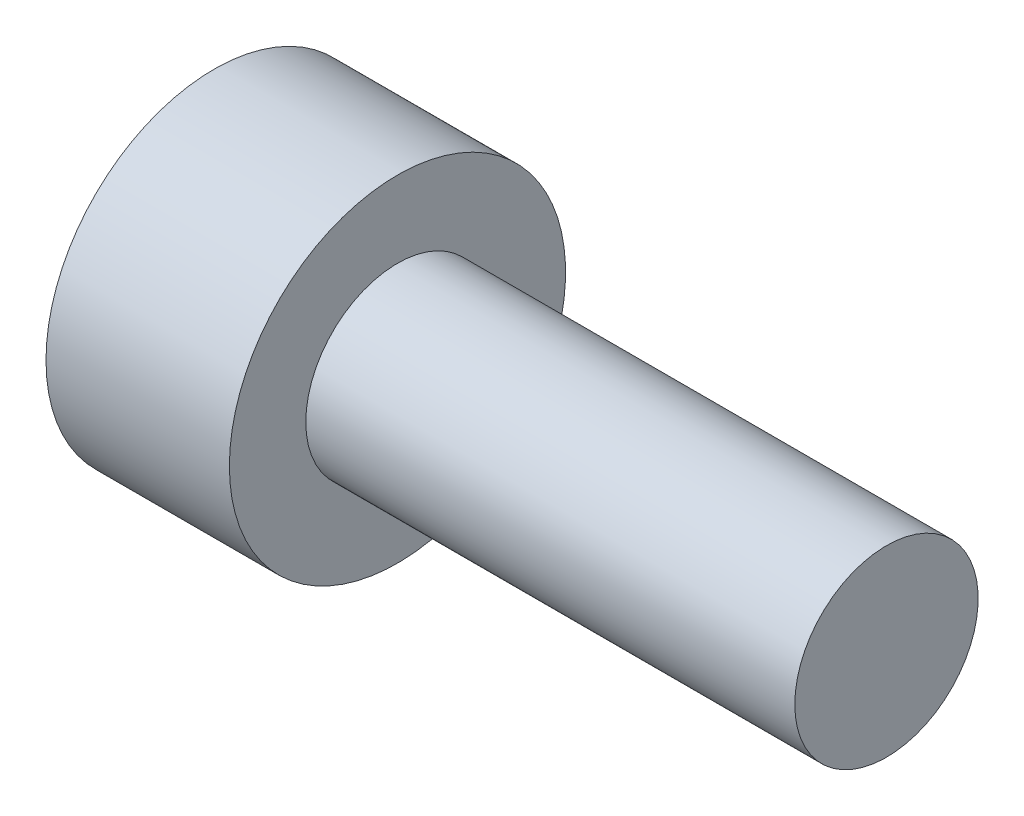
from build123d import *

# Parameters (mm, degrees)
SOCKET_DEPTH = 1.5


with BuildPart() as part:
    # Screw Sketch → Screw (revolve)
    with BuildSketch(Plane.XY):
        Polygon((-3, 0), (-3, 2.75), (0, 2.75), (0, 1.5), (8, 1.5), (8, 0), align=None)
    revolve(axis=Axis((-1000, 0, 0), (1, 0, 0)))

    # Socket Sketch → Socket (cut)
    with BuildSketch(Plane(origin=(-3, 0, 0), x_dir=(0, 0, -1), z_dir=(1, 0, 0))):
        Polygon((1.443375673, 0), (0.721687836, 1.25), (-0.721687836, 1.25), (-1.443375673, 0), (-0.721687836, -1.25), (0.721687836, -1.25), align=None)
    extrude(amount=SOCKET_DEPTH, mode=Mode.SUBTRACT)


solid = part.part
